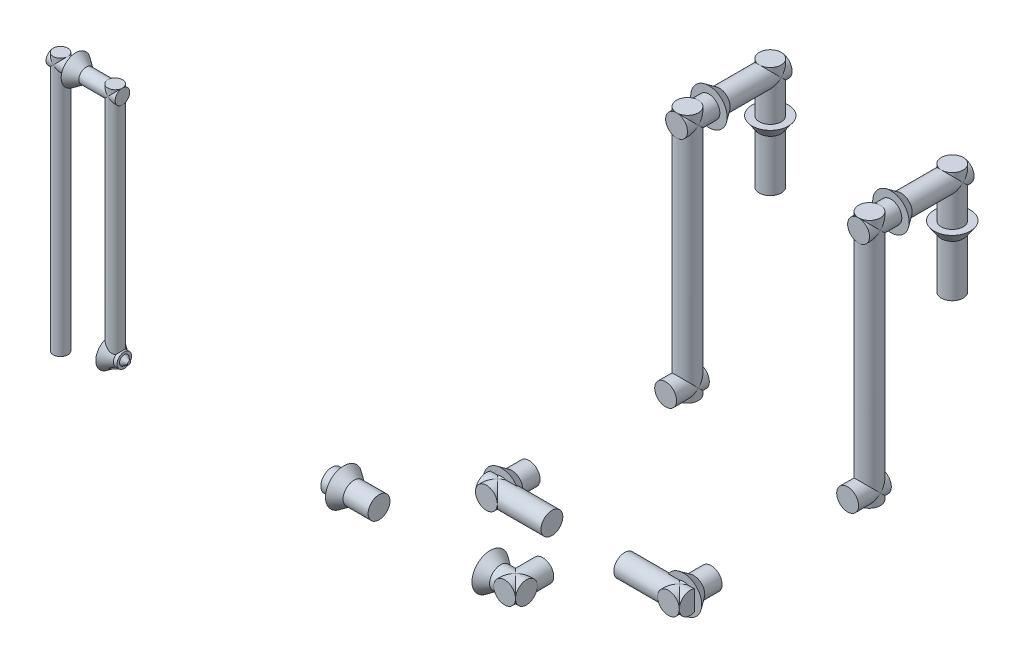
from build123d import *

# Parameters (mm, degrees)
SUCTION_JAR_TO_PUMP_1_START = 12
SKETCH1_R                   = 4
SUCTION_JAR_TO_PUMP_1_DEPTH = 142
SUCTION_JAR_TO_PUMP_2_START = -139
SKETCH2_R                   = 4
SUCTION_JAR_TO_PUMP_2_DEPTH = 38
SUCTION_JAR_TO_PUMP_3_START = 21
SKETCH3_R                   = 4
SUCTION_JAR_TO_PUMP_3_DEPTH = 133
SUCTION_JAR_TO_PUMP_4_START = -109
SKETCH4_R                   = 4
SUCTION_JAR_TO_PUMP_4_DEPTH = 9
PUMP_TO_FLOW_1_START        = 14
SKETCH5_R                   = 6
PUMP_TO_FLOW_1_DEPTH        = 26
FLOW_TO_TEE_1_START         = 100
SKETCH6_R                   = 6
FLOW_TO_TEE_1_DEPTH         = 21
FLOW_TO_TEE_2_START         = 85
SKETCH7_R                   = 6
FLOW_TO_TEE_2_DEPTH         = 21
TEE_TO_V1_RO_1_START        = 135
SKETCH8_R                   = 6
TEE_TO_V1_RO_1_DEPTH        = 36
TEE_TO_V1_RO_2_START        = 42.5
SKETCH9_R                   = 6
TEE_TO_V1_RO_2_DEPTH        = 23.5
TEE_TO_V2_BYPASS_1_START    = 59
SKETCH10_R                  = 6
TEE_TO_V2_BYPASS_1_DEPTH    = 36
TEE_TO_V2_BYPASS_2_START    = 42.5
SKETCH11_R                  = 6
TEE_TO_V2_BYPASS_2_DEPTH    = 23.5
V1_TO_RO_JAR_1_START        = -50.5
SKETCH12_R                  = 6
V1_TO_RO_JAR_1_DEPTH        = 18
V1_TO_RO_JAR_2_START        = 19
SKETCH13_R                  = 6
V1_TO_RO_JAR_2_DEPTH        = 137
V1_TO_RO_JAR_3_START        = -96
SKETCH14_R                  = 6
V1_TO_RO_JAR_3_DEPTH        = 57.5
V1_TO_RO_JAR_4_START        = 95
SKETCH15_R                  = 6
V1_TO_RO_JAR_4_DEPTH        = 61
V2_TO_BYPASS_JAR_1_START    = -50.5
SKETCH16_R                  = 6
V2_TO_BYPASS_JAR_1_DEPTH    = 18
V2_TO_BYPASS_JAR_2_START    = 19
SKETCH17_R                  = 6
V2_TO_BYPASS_JAR_2_DEPTH    = 137
V2_TO_BYPASS_JAR_3_START    = -96
SKETCH18_R                  = 6
V2_TO_BYPASS_JAR_3_DEPTH    = 57.5
V2_TO_BYPASS_JAR_4_START    = 95
SKETCH19_R                  = 6
V2_TO_BYPASS_JAR_4_DEPTH    = 61
FLOW_ARROW_1_START          = -126.641332824
SKETCH20_R                  = 8
FLOW_ARROW_1_DEPTH          = 10.282665649
FLOW_ARROW_1_TAPER          = 35
FLOW_ARROW_2_START          = -107.641332824
SKETCH21_R                  = 8
FLOW_ARROW_2_DEPTH          = 10.282665649
FLOW_ARROW_2_TAPER          = 35
FLOW_ARROW_3_START          = 20.57333397
SKETCH22_R                  = 10
FLOW_ARROW_3_DEPTH          = 12.853332061
FLOW_ARROW_3_TAPER          = 35
FLOW_ARROW_4_START          = 101.07333397
SKETCH23_R                  = 10
FLOW_ARROW_4_DEPTH          = 12.853332061
FLOW_ARROW_4_TAPER          = 35
FLOW_ARROW_5_START          = 57.67666603
SKETCH24_R                  = 10
FLOW_ARROW_5_DEPTH          = 12.853332061
FLOW_ARROW_5_DRAFT          = -35
FLOW_ARROW_6_START          = 57.67666603
SKETCH25_R                  = 10
FLOW_ARROW_6_DEPTH          = 12.853332061
FLOW_ARROW_6_DRAFT          = -35
FLOW_ARROW_7_START          = -56.27333397
SKETCH26_R                  = 10
FLOW_ARROW_7_DEPTH          = 12.853332061
FLOW_ARROW_7_DRAFT          = -35
FLOW_ARROW_8_OUTLINE_R      = 1
FLOW_ARROW_8_DEPTH          = 12.853332061
FLOW_ARROW_8_DRAFT          = -35
FLOW_ARROW_9_START          = -56.27333397
SKETCH28_R                  = 10
FLOW_ARROW_9_DEPTH          = 12.853332061
FLOW_ARROW_9_DRAFT          = -35
FLOW_ARROW_10_OUTLINE_R     = 1
FLOW_ARROW_10_DEPTH         = 12.853332061
FLOW_ARROW_10_DRAFT         = -35


# Read off the part's stored shape, not the designer's step: Flow_Arrow_8, Flow_Arrow_10
with BuildPart() as part:
    # Sketch1 → Suction_Jar_to_Pump_1 (new body)
    with BuildSketch(Plane(origin=(0, 0, 0), x_dir=(1, 0, 0), z_dir=(0, 1, 0)).offset(SUCTION_JAR_TO_PUMP_1_START)):
        with Locations(Location((-135, -100, 0), (0, 0, 270))):
            Circle(SKETCH1_R)
    extrude(amount=SUCTION_JAR_TO_PUMP_1_DEPTH)

    # Sketch2 → Suction_Jar_to_Pump_2 (add)
    with BuildSketch(Plane(origin=(0, 0, 0), x_dir=(0, 0, -1), z_dir=(1, 0, 0)).offset(SUCTION_JAR_TO_PUMP_2_START)):
        with Locations((-100, 150)):
            Circle(SKETCH2_R)
    extrude(amount=SUCTION_JAR_TO_PUMP_2_DEPTH)

    # Sketch3 → Suction_Jar_to_Pump_3 (add)
    with BuildSketch(Plane(origin=(0, 0, 0), x_dir=(1, 0, 0), z_dir=(0, 1, 0)).offset(SUCTION_JAR_TO_PUMP_3_START)):
        with Locations(Location((-105, -100, 0), (0, 0, 270))):
            Circle(SKETCH3_R)
    extrude(amount=SUCTION_JAR_TO_PUMP_3_DEPTH)

    # Sketch4 → Suction_Jar_to_Pump_4 (add)
    with BuildSketch(Plane(origin=(0, 0, 0), x_dir=(0, 0, -1), z_dir=(1, 0, 0)).offset(SUCTION_JAR_TO_PUMP_4_START)):
        with Locations((-100, 25)):
            Circle(SKETCH4_R)
    extrude(amount=SUCTION_JAR_TO_PUMP_4_DEPTH)


with BuildPart() as body_2:
    # Sketch5 → Pump_to_Flow_1 (new body)
    with BuildSketch(Plane(origin=(0, 0, 0), x_dir=(0, 0, -1), z_dir=(1, 0, 0)).offset(PUMP_TO_FLOW_1_START)):
        with Locations((-100, 25)):
            Circle(SKETCH5_R)
    extrude(amount=PUMP_TO_FLOW_1_DEPTH)


with BuildPart() as body_3:
    # Sketch6 → Flow_to_Tee_1 (new body)
    with BuildSketch(Plane(origin=(0, 0, 0), x_dir=(0, 0, -1), z_dir=(1, 0, 0)).offset(FLOW_TO_TEE_1_START)):
        with Locations(Location((-100, 25, 0), (0, 0, 180))):
            Circle(SKETCH6_R)
    extrude(amount=FLOW_TO_TEE_1_DEPTH)

    # Sketch7 → Flow_to_Tee_2 (add)
    with BuildSketch(Plane.XY.offset(FLOW_TO_TEE_2_START)):
        with Locations((115, 25)):
            Circle(SKETCH7_R)
    extrude(amount=FLOW_TO_TEE_2_DEPTH)


with BuildPart() as body_4:
    # Sketch8 → Tee_to_V1_RO_1 (new body)
    with BuildSketch(Plane(origin=(0, 0, 0), x_dir=(0, 0, -1), z_dir=(1, 0, 0)).offset(TEE_TO_V1_RO_1_START)):
        with Locations((-60, 25)):
            Circle(SKETCH8_R)
    extrude(amount=TEE_TO_V1_RO_1_DEPTH)

    # Sketch9 → Tee_to_V1_RO_2 (add)
    with BuildSketch(Plane.XY.offset(TEE_TO_V1_RO_2_START)):
        with Locations((165, 25)):
            Circle(SKETCH9_R)
    extrude(amount=TEE_TO_V1_RO_2_DEPTH)


with BuildPart() as body_5:
    # Sketch10 → Tee_to_V2_BYPASS_1 (new body)
    with BuildSketch(Plane(origin=(0, 0, 0), x_dir=(0, 0, -1), z_dir=(1, 0, 0)).offset(TEE_TO_V2_BYPASS_1_START)):
        with Locations((-60, 25)):
            Circle(SKETCH10_R)
    extrude(amount=TEE_TO_V2_BYPASS_1_DEPTH)

    # Sketch11 → Tee_to_V2_BYPASS_2 (add)
    with BuildSketch(Plane.XY.offset(TEE_TO_V2_BYPASS_2_START)):
        with Locations(Location((65, 25, 0), (0, 0, 180))):
            Circle(SKETCH11_R)
    extrude(amount=TEE_TO_V2_BYPASS_2_DEPTH)


with BuildPart() as body_6:
    # Sketch12 → V1_to_RO_Jar_1 (new body)
    with BuildSketch(Plane.XY.offset(V1_TO_RO_JAR_1_START)):
        with Locations((165, 25)):
            Circle(SKETCH12_R)
    extrude(amount=V1_TO_RO_JAR_1_DEPTH)

    # Sketch13 → V1_to_RO_Jar_2 (add)
    with BuildSketch(Plane(origin=(0, 0, 0), x_dir=(1, 0, 0), z_dir=(0, 1, 0)).offset(V1_TO_RO_JAR_2_START)):
        with Locations(Location((165, 44.5, 0), (0, 0, 90))):
            Circle(SKETCH13_R)
    extrude(amount=V1_TO_RO_JAR_2_DEPTH)

    # Sketch14 → V1_to_RO_Jar_3 (add)
    with BuildSketch(Plane.XY.offset(V1_TO_RO_JAR_3_START)):
        with Locations((165, 150)):
            Circle(SKETCH14_R)
    extrude(amount=V1_TO_RO_JAR_3_DEPTH)

    # Sketch15 → V1_to_RO_Jar_4 (add)
    with BuildSketch(Plane(origin=(0, 0, 0), x_dir=(1, 0, 0), z_dir=(0, 1, 0)).offset(V1_TO_RO_JAR_4_START)):
        with Locations(Location((165, 90, 0), (0, 0, 90))):
            Circle(SKETCH15_R)
    extrude(amount=V1_TO_RO_JAR_4_DEPTH)


with BuildPart() as body_7:
    # Sketch16 → V2_to_BYPASS_Jar_1 (new body)
    with BuildSketch(Plane.XY.offset(V2_TO_BYPASS_JAR_1_START)):
        with Locations((65, 25)):
            Circle(SKETCH16_R)
    extrude(amount=V2_TO_BYPASS_JAR_1_DEPTH)

    # Sketch17 → V2_to_BYPASS_Jar_2 (add)
    with BuildSketch(Plane(origin=(0, 0, 0), x_dir=(1, 0, 0), z_dir=(0, 1, 0)).offset(V2_TO_BYPASS_JAR_2_START)):
        with Locations(Location((65, 44.5, 0), (0, 0, 90))):
            Circle(SKETCH17_R)
    extrude(amount=V2_TO_BYPASS_JAR_2_DEPTH)

    # Sketch18 → V2_to_BYPASS_Jar_3 (add)
    with BuildSketch(Plane.XY.offset(V2_TO_BYPASS_JAR_3_START)):
        with Locations((65, 150)):
            Circle(SKETCH18_R)
    extrude(amount=V2_TO_BYPASS_JAR_3_DEPTH)

    # Sketch19 → V2_to_BYPASS_Jar_4 (add)
    with BuildSketch(Plane(origin=(0, 0, 0), x_dir=(1, 0, 0), z_dir=(0, 1, 0)).offset(V2_TO_BYPASS_JAR_4_START)):
        with Locations(Location((65, 90, 0), (0, 0, 90))):
            Circle(SKETCH19_R)
    extrude(amount=V2_TO_BYPASS_JAR_4_DEPTH)


with BuildPart() as body_8:
    # Sketch20 → Flow_Arrow_1 (new body)
    with BuildSketch(Plane(origin=(0, 0, 0), x_dir=(0, 0, -1), z_dir=(1, 0, 0)).offset(FLOW_ARROW_1_START)):
        with Locations((-100, 150)):
            Circle(SKETCH20_R)
    extrude(amount=FLOW_ARROW_1_DEPTH, taper=FLOW_ARROW_1_TAPER)


with BuildPart() as body_9:
    # Sketch21 → Flow_Arrow_2 (new body)
    with BuildSketch(Plane(origin=(0, 0, 0), x_dir=(0, 0, -1), z_dir=(1, 0, 0)).offset(FLOW_ARROW_2_START)):
        with Locations((-100, 25)):
            Circle(SKETCH21_R)
    extrude(amount=FLOW_ARROW_2_DEPTH, taper=FLOW_ARROW_2_TAPER)


with BuildPart() as body_10:
    # Sketch22 → Flow_Arrow_3 (new body)
    with BuildSketch(Plane(origin=(0, 0, 0), x_dir=(0, 0, -1), z_dir=(1, 0, 0)).offset(FLOW_ARROW_3_START)):
        with Locations((-100, 25)):
            Circle(SKETCH22_R)
    extrude(amount=FLOW_ARROW_3_DEPTH, taper=FLOW_ARROW_3_TAPER)


with BuildPart() as body_11:
    # Sketch23 → Flow_Arrow_4 (new body)
    with BuildSketch(Plane(origin=(0, 0, 0), x_dir=(0, 0, -1), z_dir=(1, 0, 0)).offset(FLOW_ARROW_4_START)):
        with Locations((-100, 25)):
            Circle(SKETCH23_R)
    extrude(amount=FLOW_ARROW_4_DEPTH, taper=FLOW_ARROW_4_TAPER)


with BuildPart() as body_12:
    # Sketch24 → Flow_Arrow_5 (with draft: the straight prism first)
    with BuildSketch(Plane.XY.offset(FLOW_ARROW_5_START)):
        with Locations((165, 25)):
            Circle(SKETCH24_R)
    extrude(amount=-FLOW_ARROW_5_DEPTH)
    # Flow_Arrow_5: the draft: its side faces are tilted about the plane it starts from
    flow_arrow_5_sides = [body_12.faces().sort_by_distance(p)[0] for p in [
        (155, 25, 51.25),
    ]]
    draft(flow_arrow_5_sides, Plane.XY.offset(FLOW_ARROW_5_START), FLOW_ARROW_5_DRAFT)


with BuildPart() as body_13:
    # Sketch25 → Flow_Arrow_6 (with draft: the straight prism first)
    with BuildSketch(Plane.XY.offset(FLOW_ARROW_6_START)):
        with Locations((65, 25)):
            Circle(SKETCH25_R)
    extrude(amount=-FLOW_ARROW_6_DEPTH)
    # Flow_Arrow_6: the draft: its side faces are tilted about the plane it starts from
    flow_arrow_6_sides = [body_13.faces().sort_by_distance(p)[0] for p in [
        (55, 25, 51.25),
    ]]
    draft(flow_arrow_6_sides, Plane.XY.offset(FLOW_ARROW_6_START), FLOW_ARROW_6_DRAFT)


with BuildPart() as body_14:
    # Sketch26 → Flow_Arrow_7 (with draft: the straight prism first)
    with BuildSketch(Plane.XY.offset(FLOW_ARROW_7_START)):
        with Locations((165, 150)):
            Circle(SKETCH26_R)
    extrude(amount=-FLOW_ARROW_7_DEPTH)
    # Flow_Arrow_7: the draft: its side faces are tilted about the plane it starts from
    flow_arrow_7_sides = [body_14.faces().sort_by_distance(p)[0] for p in [
        (155, 150, -62.7),
    ]]
    draft(flow_arrow_7_sides, Plane.XY.offset(FLOW_ARROW_7_START), FLOW_ARROW_7_DRAFT)


with BuildPart() as body_15:
    # Flow_Arrow_8 outline → Flow_Arrow_8 (with draft: the straight prism first)
    with BuildSketch(Plane(origin=(0, 116.07333397, 0), x_dir=(1, 0, 0), z_dir=(0, 1, 0))):
        with Locations((165, 90)):
            Circle(FLOW_ARROW_8_OUTLINE_R)
    extrude(amount=FLOW_ARROW_8_DEPTH)
    # Flow_Arrow_8: the draft: its side faces are tilted about the plane it starts from
    flow_arrow_8_sides = [body_15.faces().sort_by_distance(p)[0] for p in [
        (164, 122.5, -90),
    ]]
    draft(flow_arrow_8_sides, Plane(origin=(0, 116.07333397, 0), x_dir=(1, 0, 0), z_dir=(0, 1, 0)), FLOW_ARROW_8_DRAFT)


with BuildPart() as body_16:
    # Sketch28 → Flow_Arrow_9 (with draft: the straight prism first)
    with BuildSketch(Plane.XY.offset(FLOW_ARROW_9_START)):
        with Locations((65, 150)):
            Circle(SKETCH28_R)
    extrude(amount=-FLOW_ARROW_9_DEPTH)
    # Flow_Arrow_9: the draft: its side faces are tilted about the plane it starts from
    flow_arrow_9_sides = [body_16.faces().sort_by_distance(p)[0] for p in [
        (55, 150, -62.7),
    ]]
    draft(flow_arrow_9_sides, Plane.XY.offset(FLOW_ARROW_9_START), FLOW_ARROW_9_DRAFT)


with BuildPart() as body_17:
    # Flow_Arrow_10 outline → Flow_Arrow_10 (with draft: the straight prism first)
    with BuildSketch(Plane(origin=(0, 116.07333397, 0), x_dir=(1, 0, 0), z_dir=(0, 1, 0))):
        with Locations((65, 90)):
            Circle(FLOW_ARROW_10_OUTLINE_R)
    extrude(amount=FLOW_ARROW_10_DEPTH)
    # Flow_Arrow_10: the draft: its side faces are tilted about the plane it starts from
    flow_arrow_10_sides = [body_17.faces().sort_by_distance(p)[0] for p in [
        (64, 122.5, -90),
    ]]
    draft(flow_arrow_10_sides, Plane(origin=(0, 116.07333397, 0), x_dir=(1, 0, 0), z_dir=(0, 1, 0)), FLOW_ARROW_10_DRAFT)


solid = Compound([part.part, body_2.part, body_3.part, body_4.part, body_5.part, body_6.part, body_7.part, body_8.part, body_9.part, body_10.part, body_11.part, body_12.part, body_13.part, body_14.part, body_15.part, body_16.part, body_17.part])
